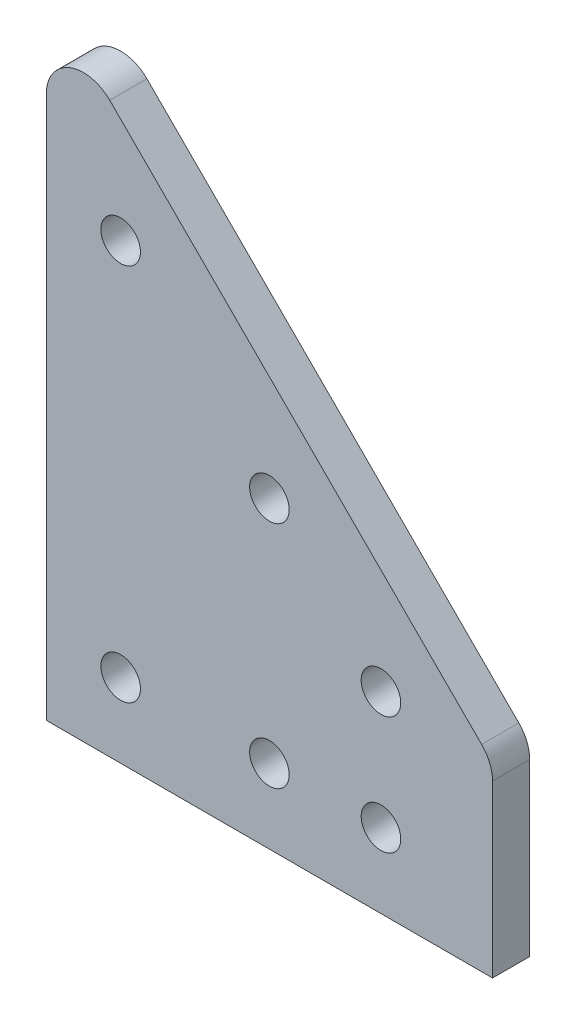
from build123d import *

# Parameters (mm, degrees)
BOSS_EXTRUDE1_DEPTH     = 3.175
F_1_4_CLEARANCE_HOLE1_D = 6.7564
FILLET1_R               = 6.35


with BuildPart() as part:
    # Sketch1 → Boss-Extrude1 (new, symmetric)
    with BuildSketch(Plane.XY):
        Polygon((-38.1, -15.875), (38.1, -15.875), (38.1, 15.875), (-38.1, 92.075), align=None)
    extrude(amount=BOSS_EXTRUDE1_DEPTH, both=True)

    # 1/4 Clearance Hole1 (through all)
    with Locations(Plane.XY.offset(3.175)):
        with Locations((-25.4, 61.414487758), (0, 36.014487758), (19.05, 16.964487758), (-25.4, -3.175), (19.05, -3.175), (0, -3.175)):
            Hole(F_1_4_CLEARANCE_HOLE1_D / 2)

    # Fillet1
    fillet1_edges = [part.edges().sort_by_distance(p)[0] for p in [
        (38.1, 15.875, 0),
        (-38.1, 92.075, 0),
    ]]
    fillet(fillet1_edges, radius=FILLET1_R)


solid = part.part
